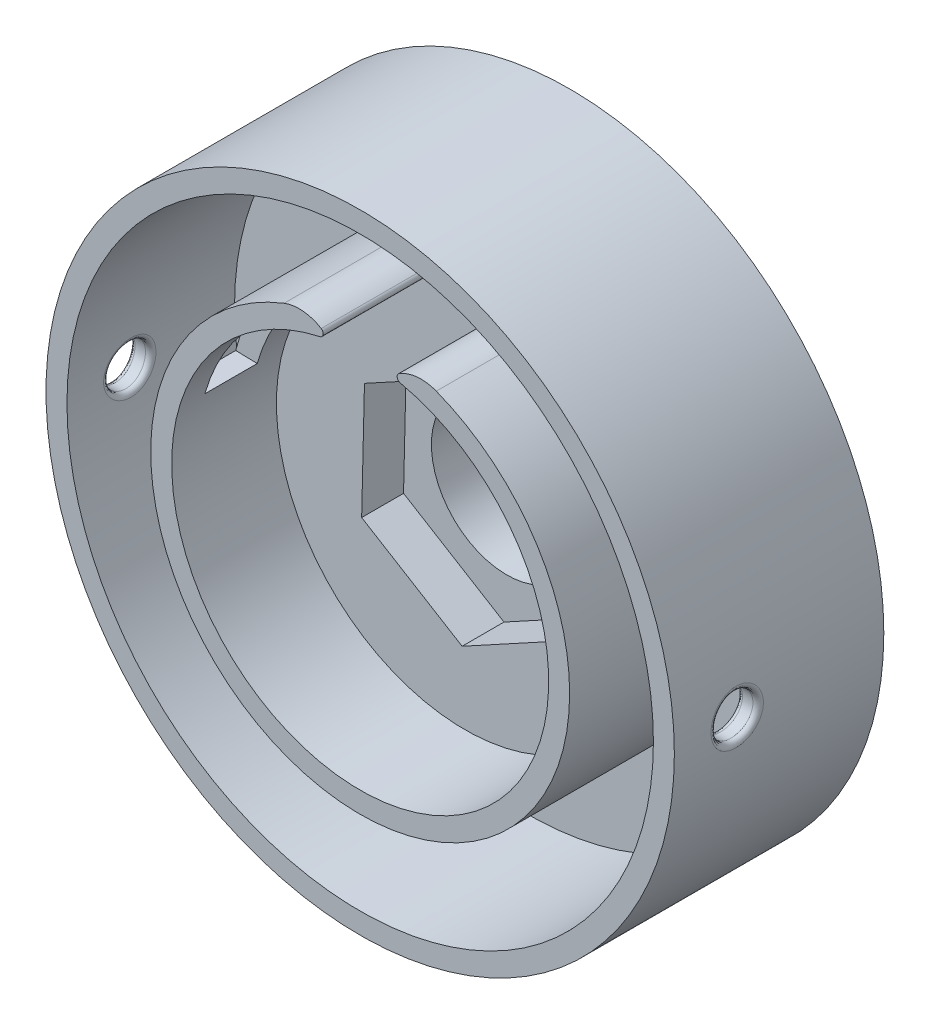
from build123d import *

# Parameters (mm, degrees)
SKETCH1_R                = 15
BOSS_EXTRUDE1_DEPTH      = 10
SKETCH2_R                = 3.6
CUT_EXTRUDE1_DEPTH       = 24.452078799
SKETCH3_R                = 9
CUT_EXTRUDE2_DEPTH       = 5
CUT_EXTRUDE3_DEPTH       = 2
SKETCH5_R                = 14
SKETCH5_R_2              = 10
CUT_EXTRUDE4_DEPTH       = 8
SKETCH7_W                = 3
SKETCH7_H                = 3.361478456
CUT_EXTRUDE6_DEPTH       = 5
FILLET2_R                = 2
FILLET3_R                = 0.2
SKETCH8_W                = 4.4
SKETCH8_H                = 2.4
CUT_EXTRUDE7_DEPTH       = 3
SKETCH9_W                = 2.5
SKETCH9_H                = 4
CUT_EXTRUDE8_DEPTH       = 15
CUT_EXTRUDE9_REACH       = 37
CUT_EXTRUDE9_END_RADIUS  = 14
SKETCH10_R               = 1
FILLET6_R                = 0.25
CUT_EXTRUDE11_REACH      = 37
CUT_EXTRUDE11_END_RADIUS = 14
SKETCH12_R               = 1
FILLET7_R                = 0.25


with BuildPart() as part:
    # Sketch1 → Boss-Extrude1 (new body)
    with BuildSketch(Plane.XY):
        Circle(SKETCH1_R)
    extrude(amount=BOSS_EXTRUDE1_DEPTH)

    # Sketch2 → Cut-Extrude1 (cut, through all)
    with BuildSketch(Plane.XY.offset(10)):
        Circle(SKETCH2_R)
    extrude(amount=-CUT_EXTRUDE1_DEPTH, mode=Mode.SUBTRACT)

    # Sketch3 → Cut-Extrude2 (cut)
    with BuildSketch(Plane.XY.offset(10)):
        Circle(SKETCH3_R)
    extrude(amount=-CUT_EXTRUDE2_DEPTH, mode=Mode.SUBTRACT)

    # Sketch4 → Cut-Extrude3 (cut)
    with BuildSketch(Plane.XY.offset(5)):
        Polygon((4.795841849, -2.923358252), (4.929623435, 2.691641748), (0.133781586, 5.615), (-4.795841849, 2.923358252), (-4.929623435, -2.691641748), (-0.133781586, -5.615), align=None)
    extrude(amount=-CUT_EXTRUDE3_DEPTH, mode=Mode.SUBTRACT)

    # Sketch5 → Cut-Extrude4 (cut)
    with BuildSketch(Plane.XY.offset(10)):
        Circle(SKETCH5_R)
        Circle(SKETCH5_R_2, mode=Mode.SUBTRACT)
    extrude(amount=-CUT_EXTRUDE4_DEPTH, mode=Mode.SUBTRACT)

    # Sketch7 → Cut-Extrude6 (cut)
    with BuildSketch(Plane.XY.offset(10)):
        with Locations((0, 10.554858903)):
            Rectangle(SKETCH7_W, SKETCH7_H)
    extrude(amount=-CUT_EXTRUDE6_DEPTH, mode=Mode.SUBTRACT)

    # Fillet2
    # the kernel refuses this fillet: 2 mm, written as the material it takes off along each edge
    with BuildSketch(Plane(origin=(-1.5, 9.886859967, 5), x_dir=(-0.9660683179575952, -0.2582866722047086, 0), z_dir=(0, 0, 1))) as fillet2_piece_1:
        with BuildLine():
            CenterArc((1.988175028, 1.987762437), FILLET2_R, 210.310979349, 66.030517682)
            Line((0.26157732, 0.97837631), (0.227045366, 0.958188588))
            ThreePointArc((0.227045366, 0.958188588), (0.092145927, 0.499519622), (-0.038642733, 0.010331467))
            Line((-0.038642733, 0.010331467), (-0.004418167, -0.039755249))
            ThreePointArc((-0.004418167, -0.039755249), (1.104541682, -0.101187814), (2.213501532, -0.039755249))
            Line((2.213501532, -0.039755249), (2.209083365, 0))
        make_face()
    extrude(amount=10.522708412, mode=Mode.SUBTRACT)
    with BuildSketch(Plane(origin=(1.5, 9.886859967, 5), x_dir=(0.9660683179575953, -0.25828667220470874, 0), z_dir=(0, 0, 1))) as fillet2_piece_2:
        with BuildLine():
            CenterArc((1.988175028, -1.987762437), FILLET2_R, 83.658502968, 66.030517682)
            Line((0.26157732, -0.97837631), (0.227045366, -0.958188588))
            ThreePointArc((0.227045366, -0.958188588), (0.092145927, -0.499519622), (-0.038642733, -0.010331467))
            Line((-0.038642733, -0.010331467), (-0.004418167, 0.039755249))
            ThreePointArc((-0.004418167, 0.039755249), (1.104541682, 0.101187814), (2.213501532, 0.039755249))
            Line((2.213501532, 0.039755249), (2.209083365, 0))
        make_face()
    extrude(amount=10.522708412, mode=Mode.SUBTRACT)

    # Fillet3
    fillet3_edges = [part.edges().sort_by_distance(p)[0] for p in [
        (-1.5, 8.874119675, 7.5),
        (1.5, 8.874119675, 7.5),
    ]]
    fillet(fillet3_edges, radius=FILLET3_R)

    # Sketch8 → Cut-Extrude7 (cut)
    with BuildSketch(Plane(origin=(0, 0, 0), x_dir=(-1, 0, 0), z_dir=(0, 0, -1))):
        with Locations((0, -7.15)):
            Rectangle(SKETCH8_W, SKETCH8_H)
    extrude(amount=-CUT_EXTRUDE7_DEPTH, mode=Mode.SUBTRACT)

    # Sketch9 → Cut-Extrude8 (cut)
    with BuildSketch(Plane(origin=(4.862732642, -0.115858252, 0), x_dir=(0, 0, 1), z_dir=(-0.999716287603517, 0.02381899032793182, 0))):
        with Locations((7.5, 4.227078832)):
            Rectangle(SKETCH9_W, SKETCH9_H)
    extrude(amount=CUT_EXTRUDE8_DEPTH, mode=Mode.SUBTRACT)

    # Cut-Extrude9: up to this cylinder (the profile starts outside it)
    cut_extrude9_end = Plane(origin=(0, 0, 7), z_dir=(0, 0, 1)) * Cylinder(CUT_EXTRUDE9_END_RADIUS, 103, mode=Mode.PRIVATE)
    # Sketch10 → Cut-Extrude9 (cut, up to the surface)
    with BuildSketch(Plane(origin=(15, 0, 0), x_dir=(0, 0, -1), z_dir=(1, 0, 0)), mode=Mode.PRIVATE) as cut_extrude9_sk1:
        with Locations((-7, 0)):
            Circle(SKETCH10_R)
    cut_extrude9_tool1 = extrude(cut_extrude9_sk1.sketch, amount=-CUT_EXTRUDE9_REACH, mode=Mode.PRIVATE) - cut_extrude9_end
    add(cut_extrude9_tool1.solids().sort_by_distance((15, 0, 7))[0], mode=Mode.SUBTRACT)

    # Fillet6
    fillet6_edges = [part.edges().sort_by_distance(p)[0] for p in [
        (13.964240044, 1, 7),
        (14.966629547, -1, 7),
    ]]
    fillet(fillet6_edges, radius=FILLET6_R)

    # Cut-Extrude11: up to this cylinder (the profile starts outside it)
    cut_extrude11_end = Plane(origin=(0, 0, 7), z_dir=(0, 0, 1)) * Cylinder(CUT_EXTRUDE11_END_RADIUS, 103, mode=Mode.PRIVATE)
    # Sketch12 → Cut-Extrude11 (cut, up to the surface)
    with BuildSketch(Plane(origin=(-15, 0, 0), x_dir=(0, 0, -1), z_dir=(1, 0, 0)), mode=Mode.PRIVATE) as cut_extrude11_sk1:
        with Locations(Location((-7, 0, 0), (0, 0, 347.655759474))):
            Circle(SKETCH12_R)
    cut_extrude11_tool1 = extrude(cut_extrude11_sk1.sketch, amount=CUT_EXTRUDE11_REACH, mode=Mode.PRIVATE) - cut_extrude11_end
    add(cut_extrude11_tool1.solids().sort_by_distance((-15, 0, 7))[0], mode=Mode.SUBTRACT)

    # Fillet7
    fillet7_edges = [part.edges().sort_by_distance(p)[0] for p in [
        (-13.998367613, 0.213784745, 7.976880801),
        (-14.998476451, 0.213784745, 7.976880801),
    ]]
    fillet(fillet7_edges, radius=FILLET7_R)


solid = part.part
